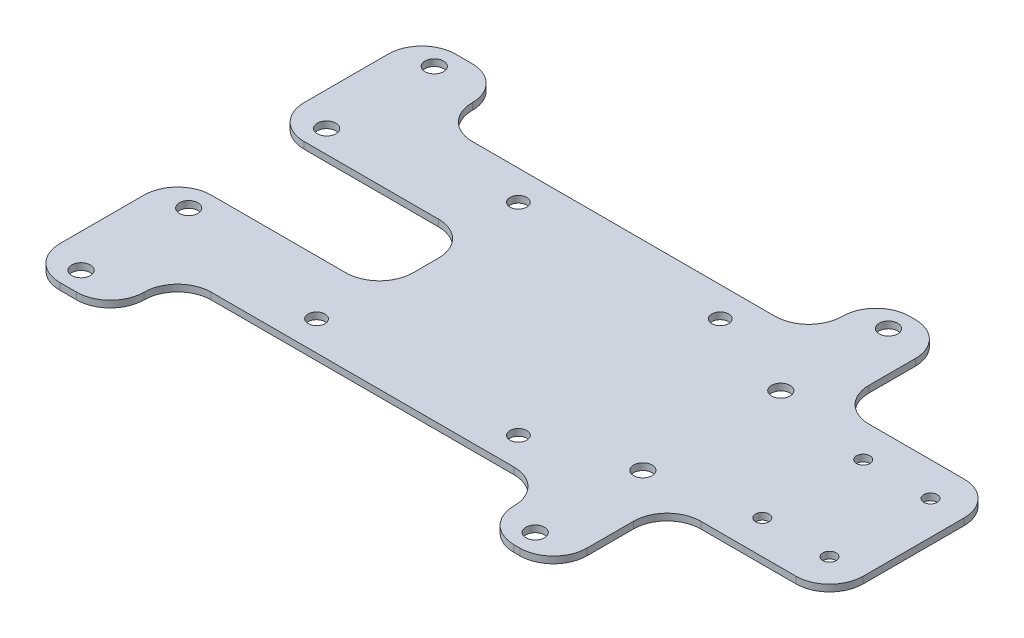
from build123d import *

# Parameters (mm, degrees)
SKETCH1_W           = 80
SKETCH1_H           = 140
BOSS_EXTRUDE1_DEPTH = 2
SKETCH4_W           = 140
SKETCH4_H           = 2
BOSS_EXTRUDE2_DEPTH = 35
SKETCH5_W           = 140
SKETCH5_H           = 2
BOSS_EXTRUDE3_DEPTH = 20
SKETCH2_R           = 2.5
CUT_EXTRUDE1_DEPTH  = 10
SKETCH7_W           = 140
SKETCH7_H           = 2
BOSS_EXTRUDE5_DEPTH = 20
SKETCH8_R           = 2.75
CUT_EXTRUDE2_DEPTH  = 10
SKETCH9_W           = 50
SKETCH9_H           = 2
BOSS_EXTRUDE6_DEPTH = 50
SKETCH10_R          = 2
CUT_EXTRUDE3_DEPTH  = 40
CUT_EXTRUDE4_DEPTH  = 40
CHAMFER1_SIZE       = 49.985180236
CHAMFER1_SIZE_2     = 35
SKETCH12_W          = 60
SKETCH12_H          = 27.596233816
CUT_EXTRUDE5_DEPTH  = 10
CUT_EXTRUDE6_DEPTH  = 10
SKETCH14_W          = 110
SKETCH14_H          = 20
CUT_EXTRUDE7_DEPTH  = 10
FILLET1_R           = 10


# Some blends are built 0.0001 mm under size
with BuildPart() as part:
    # Sketch1 → Boss-Extrude1 (new body)
    with BuildSketch(Plane(origin=(0, 0, 0), x_dir=(1, 0, 0), z_dir=(0, 1, 0))):
        with Locations((40, 70)):
            Rectangle(SKETCH1_W, SKETCH1_H)
    extrude(amount=BOSS_EXTRUDE1_DEPTH)

    # Sketch4 → Boss-Extrude2 (add)
    with BuildSketch(Plane(origin=(80, 0, 0), x_dir=(0, 0, -1), z_dir=(1, 0, 0))):
        with Locations((70, 1)):
            Rectangle(SKETCH4_W, SKETCH4_H)
    extrude(amount=BOSS_EXTRUDE2_DEPTH)

    # Sketch5 → Boss-Extrude3 (add)
    with BuildSketch(Plane(origin=(115, 0, 0), x_dir=(0, 0, -1), z_dir=(1, 0, 0))):
        with Locations((70, 1)):
            Rectangle(SKETCH5_W, SKETCH5_H)
    extrude(amount=BOSS_EXTRUDE3_DEPTH)

    # Sketch2 → Cut-Extrude1 (cut)
    with BuildSketch(Plane.XZ):
        with Locations(Location((97.5, -100, 0), (0, 0, 270))):
            Circle(SKETCH2_R)
        with Locations(Location((97.5, -40, 0), (0, 0, 270))):
            Circle(SKETCH2_R)
        with Locations(Location((37.5, -40, 0), (0, 0, 270))):
            Circle(SKETCH2_R)
        with Locations(Location((37.5, -100, 0), (0, 0, 270))):
            Circle(SKETCH2_R)
    extrude(amount=-CUT_EXTRUDE1_DEPTH, mode=Mode.SUBTRACT)

    # Sketch7 → Boss-Extrude5 (add)
    with BuildSketch(Plane.ZY):
        with Locations((-70, 1)):
            Rectangle(SKETCH7_W, SKETCH7_H)
    extrude(amount=BOSS_EXTRUDE5_DEPTH)

    # Sketch8 → Cut-Extrude2 (cut)
    with BuildSketch(Plane.XZ):
        with Locations(Location((125, -17.5, 0), (0, 0, 270))):
            Circle(SKETCH8_R)
        with Locations(Location((125, -49.5, 0), (0, 0, 270))):
            Circle(SKETCH8_R)
        with Locations(Location((125, -90.5, 0), (0, 0, 270))):
            Circle(SKETCH8_R)
        with Locations(Location((125, -122.5, 0), (0, 0, 270))):
            Circle(SKETCH8_R)
        with Locations(Location((-10, -122.5, 0), (0, 0, 90))):
            Circle(SKETCH8_R)
        with Locations(Location((-10, -90.5, 0), (0, 0, 90))):
            Circle(SKETCH8_R)
        with Locations(Location((-10, -49.5, 0), (0, 0, 90))):
            Circle(SKETCH8_R)
        with Locations(Location((-10, -17.5, 0), (0, 0, 90))):
            Circle(SKETCH8_R)
    extrude(amount=-CUT_EXTRUDE2_DEPTH, mode=Mode.SUBTRACT)

    # Sketch9 → Boss-Extrude6 (add)
    with BuildSketch(Plane(origin=(135, 0, 0), x_dir=(0, 0, -1), z_dir=(1, 0, 0))):
        with Locations((70, 1)):
            Rectangle(SKETCH9_W, SKETCH9_H)
    extrude(amount=BOSS_EXTRUDE6_DEPTH)

    # Sketch10 → Cut-Extrude3 (cut)
    with BuildSketch(Plane.XZ):
        with Locations(Location((175, -55, 0), (0, 0, 270))):
            Circle(SKETCH10_R)
        with Locations(Location((175, -85, 0), (0, 0, 270))):
            Circle(SKETCH10_R)
        with Locations(Location((155, -85, 0), (0, 0, 270))):
            Circle(SKETCH10_R)
        with Locations(Location((155, -55, 0), (0, 0, 270))):
            Circle(SKETCH10_R)
    extrude(amount=-CUT_EXTRUDE3_DEPTH, mode=Mode.SUBTRACT)

    # Sketch11 → Cut-Extrude4 (cut)
    with BuildSketch(Plane.XZ):
        Polygon((135, -11.201883092), (22.258688724, -11.201883092), (-20, -11.201883092), (-20, 0), (135, 0), align=None)
        Polygon((135, -140), (135, -128.798116908), (22.258688724, -128.798116908), (-20, -128.798116908), (-20, -140), align=None)
    extrude(amount=-CUT_EXTRUDE4_DEPTH, mode=Mode.SUBTRACT)

    # Chamfer1
    # the kernel refuses this chamfer: 49.985180236, 35 mm, written as the material it adds along each edge
    with BuildSketch(Plane(origin=(135, 2, -95), x_dir=(0.9997533347641299, 0, 0.022209674198457038), z_dir=(0, -1, 0))) as chamfer1_piece_1_section:
        Polygon((CHAMFER1_SIZE * 0.999753334764, -CHAMFER1_SIZE * 0.0222096741984), (-CHAMFER1_SIZE_2 * 0.0222096741985, -CHAMFER1_SIZE_2 * 0.999753334764), (0, 0), align=None)
    chamfer1_piece_1 = extrude(amount=2, mode=Mode.PRIVATE)
    chamfer1_piece_1 = split(chamfer1_piece_1, bisect_by=Plane(origin=(151.760683993, 1, -128.798116908), z_dir=(0, 0, 1)), keep=Keep.TOP, mode=Mode.PRIVATE)
    add(chamfer1_piece_1)
    with BuildSketch(Plane(origin=(135, 0, -45), x_dir=(-0.045263737714021514, 0, 0.9989750717851553), z_dir=(0, 1, 0))) as chamfer1_piece_2_section:
        Polygon((CHAMFER1_SIZE_2 * 0.998975071785, CHAMFER1_SIZE_2 * 0.045263737714), (-CHAMFER1_SIZE * 0.045263737714, CHAMFER1_SIZE * 0.998975071785), (0, 0), align=None)
    chamfer1_piece_2 = extrude(amount=2, mode=Mode.PRIVATE)
    chamfer1_piece_2 = split(chamfer1_piece_2, bisect_by=Plane(origin=(151.760683993, 1, -11.201883092), z_dir=(0, 0, -1)), keep=Keep.TOP, mode=Mode.PRIVATE)
    add(chamfer1_piece_2)

    # Sketch12 → Cut-Extrude5 (cut)
    with BuildSketch(Plane.XZ):
        with Locations((10, -70)):
            Rectangle(SKETCH12_W, SKETCH12_H)
    extrude(amount=-CUT_EXTRUDE5_DEPTH, mode=Mode.SUBTRACT)

    # Sketch13 → Cut-Extrude6 (cut)
    with BuildSketch(Plane.XZ):
        Polygon((184.985180236, -45), (136.716466943, -45), (136.716466943, -11.201883092), align=None)
        Polygon((184.985180236, -95), (136.716466943, -128.798116908), (136.716466943, -95), align=None)
    extrude(amount=-CUT_EXTRUDE6_DEPTH, mode=Mode.SUBTRACT)

    # Sketch14 → Cut-Extrude7 (cut)
    with BuildSketch(Plane.XZ):
        with Locations((60, -21.201883092)):
            Rectangle(SKETCH14_W, SKETCH14_H)
        with Locations((60, -118.798116908)):
            Rectangle(SKETCH14_W, SKETCH14_H)
    extrude(amount=-CUT_EXTRUDE7_DEPTH, mode=Mode.SUBTRACT)

    # Fillet1
    fillet1_edges = [part.edges().sort_by_distance(p)[0] for p in [
        (185, 1, -45),
        (185, 1, -95),
        (-20, 1, -128.798116908),
        (-20, 1, -11.201883092),
        (136.716466943, 1, -128.798116908),
        (136.716466943, 1, -11.201883092),
        (-20, 1, -83.798116908),
        (-20, 1, -56.201883092),
        (40, 1, -56.201883092),
        (40, 1, -83.798116908),
        (136.716466943, 1, -45),
        (136.716466943, 1, -95),
        (115, 1, -11.201883092),
        (5, 1, -11.201883092),
        (5, 1, -128.798116908),
        (115, 1, -128.798116908),
        (5, 1, -31.201883092),
        (115, 1, -31.201883092),
        (115, 1, -108.798116908),
        (5, 1, -108.798116908),
    ]]
    fillet(fillet1_edges, radius=FILLET1_R - 0.0001)  # a hair under: the kernel refuses the full size


solid = part.part
